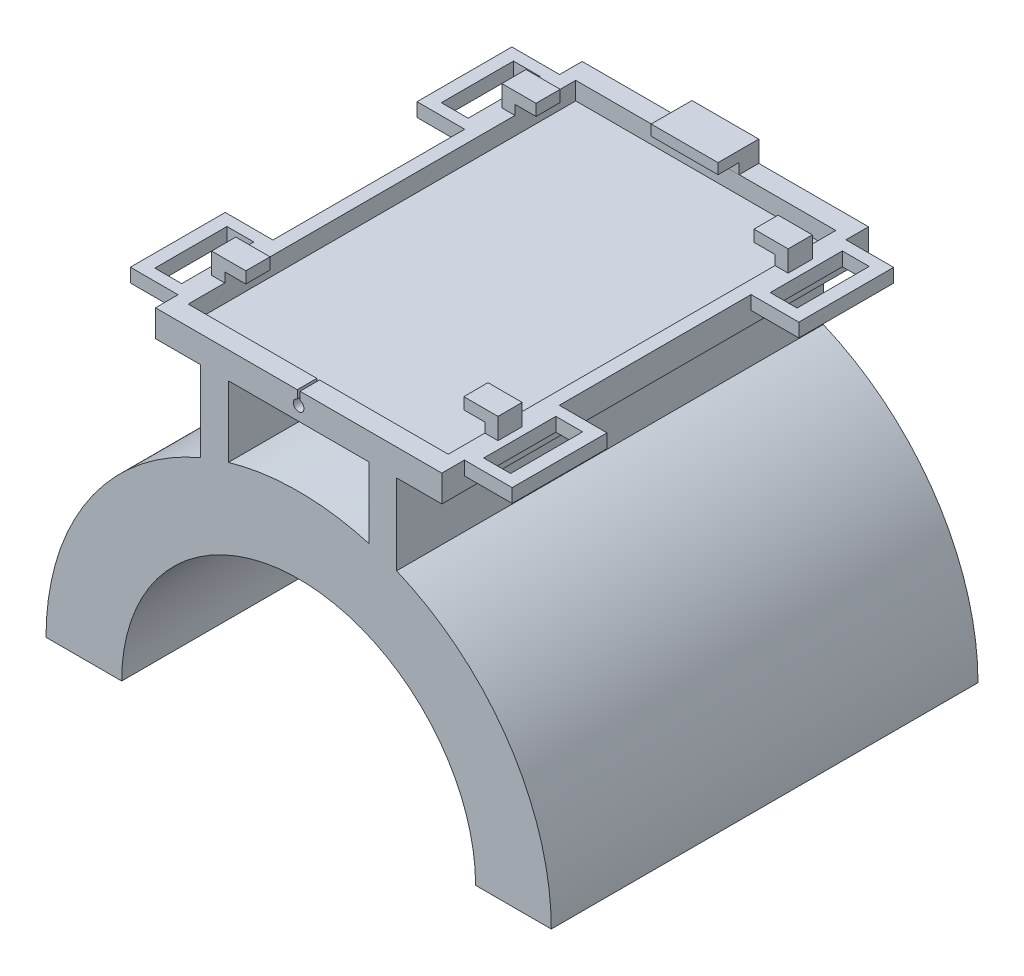
from build123d import *

# Parameters (mm, degrees)
SKETCH1_W                 = 102
SKETCH1_H                 = 152
BOSS_EXTRUDE1_DEPTH       = 3.175
SKETCH2_W                 = 102
SKETCH2_H                 = 152
SKETCH2_W_2               = 92.642768756
SKETCH2_H_2               = 138.055890694
BOSS_EXTRUDE2_DEPTH       = 6.35
CUT_EXTRUDE1_DEPTH        = 161.610477943
CUT_EXTRUDE1_DEPTH_BACK   = 7.175
SKETCH7_W                 = 4.678615622
SKETCH7_H                 = 8.620967169
BOSS_EXTRUDE3_DEPTH       = 7.5
SKETCH8_W                 = 8.620967169
SKETCH8_H                 = 4.074668009
BOSS_EXTRUDE4_DEPTH       = 7.5
MIRROR3_COPY_1_SKETCH_W   = 4.678615622
MIRROR3_COPY_1_SKETCH_H   = 8.620967169
MIRROR3_COPY_1_DEPTH      = 7.5
MIRROR3_COPY_2_SKETCH_W   = 8.620967169
MIRROR3_COPY_2_SKETCH_H   = 4.074668009
MIRROR3_COPY_2_DEPTH      = 7.5
MIRROR3_COPY_3_SKETCH_W   = 4.678615622
MIRROR3_COPY_3_SKETCH_H   = 8.620967169
MIRROR3_COPY_3_DEPTH      = 7.5
MIRROR3_COPY_4_SKETCH_W   = 8.620967169
MIRROR3_COPY_4_SKETCH_H   = 4.074668009
MIRROR3_COPY_4_DEPTH      = 7.5
SKETCH9_W                 = 23.808255756
SKETCH9_H                 = 7.018382857
BOSS_EXTRUDE5_DEPTH       = 7.5
SKETCH10_W                = 23.808255756
SKETCH10_H                = 3.75
BOSS_EXTRUDE6_DEPTH       = 7.5
BOSS_EXTRUDE8_DEPTH       = 76
BOSS_EXTRUDE8_DEPTH_BACK  = 76
BOSS_EXTRUDE10_REACH      = 164.292
BOSS_EXTRUDE10_END_RADIUS = 90
SKETCH14_W                = 9.847508611
SKETCH14_H                = 152
SKETCH26_W                = 33.786428513
SKETCH26_H                = 4.878215465
BOSS_EXTRUDE14_DEPTH      = 17
SKETCH27_W                = 9.556867484
SKETCH27_H                = 25.688859796
CUT_EXTRUDE3_DEPTH        = 17
MIRROR11_COPY_1_SKETCH_W  = 33.786428513
MIRROR11_COPY_1_SKETCH_H  = 4.878215465
MIRROR11_COPY_1_DEPTH     = 17
MIRROR11_COPY_2_SKETCH_W  = 9.556867484
MIRROR11_COPY_2_SKETCH_H  = 25.688859796
MIRROR11_COPY_2_DEPTH     = 17
MIRROR11_COPY_3_SKETCH_W  = 9.556867484
MIRROR11_COPY_3_SKETCH_H  = 25.688859796
MIRROR11_COPY_3_DEPTH     = 17


with BuildPart() as part:
    # Sketch1 → Boss-Extrude1 (new body)
    with BuildSketch(Plane(origin=(0, 0, 0), x_dir=(1, 0, 0), z_dir=(0, 1, 0))):
        Rectangle(SKETCH1_W, SKETCH1_H)
    extrude(amount=BOSS_EXTRUDE1_DEPTH)

    # Sketch2 → Boss-Extrude2 (add)
    with BuildSketch(Plane(origin=(0, 3.175, 0), x_dir=(1, 0, 0), z_dir=(0, 1, 0))):
        Rectangle(SKETCH2_W, SKETCH2_H)
        Rectangle(SKETCH2_W_2, SKETCH2_H_2, mode=Mode.SUBTRACT)
    extrude(amount=BOSS_EXTRUDE2_DEPTH)

    # Sketch5 → Cut-Extrude1 (cut, two sides: drawn at the far end of the back side and taken through both)
    with BuildSketch(Plane.XY.offset(76).offset(-CUT_EXTRUDE1_DEPTH_BACK)):
        with BuildLine():
            Line((-0.489433414, 9.525), (0.489433414, 9.525))
            Line((0.489433414, 9.525), (0.489433414, 6.660364011))
            ThreePointArc((0.489433414, 6.660364011), (0, 2.954695186), (-0.489433414, 6.660364011))
            Line((-0.489433414, 6.660364011), (-0.489433414, 9.525))
        make_face()
    extrude(amount=CUT_EXTRUDE1_DEPTH + CUT_EXTRUDE1_DEPTH_BACK, mode=Mode.SUBTRACT)

    # Sketch7 → Boss-Extrude3 (add)
    with BuildSketch(Plane(origin=(0, 9.525, 0), x_dir=(1, 0, 0), z_dir=(0, 1, 0))):
        with Locations((-48.660692189, -51.682411919)):
            Rectangle(SKETCH7_W, SKETCH7_H)
    boss_extrude3 = extrude(amount=BOSS_EXTRUDE3_DEPTH)

    # Sketch8 → Boss-Extrude4 (add)
    with BuildSketch(Plane(origin=(-46.321384378, 0, 0), x_dir=(0, 0, -1), z_dir=(1, 0, 0))):
        with Locations((-51.682411919, 14.987665996)):
            Rectangle(SKETCH8_W, SKETCH8_H)
    boss_extrude4 = extrude(amount=BOSS_EXTRUDE4_DEPTH)

    # Mirror1: Boss-Extrude3, Boss-Extrude4 across plane
    add(boss_extrude3.mirror(Plane(origin=(0, 0, 0), x_dir=(0, 0, 1), z_dir=(1, 0, 0))))
    add(boss_extrude4.mirror(Plane(origin=(0, 0, 0), x_dir=(0, 0, 1), z_dir=(1, 0, 0))))

    # Mirror3 copy 1 sketch → Mirror3 copy 1 (add)
    with BuildSketch(Plane(origin=(0, 9.525, 0), x_dir=(-1, 0, 0), z_dir=(0, 1, 0))):
        with Locations((-48.660692189, -51.682411919)):
            Rectangle(MIRROR3_COPY_1_SKETCH_W, MIRROR3_COPY_1_SKETCH_H)
    extrude(amount=MIRROR3_COPY_1_DEPTH)

    # Mirror3 copy 2 sketch → Mirror3 copy 2 (add)
    with BuildSketch(Plane.ZY.offset(-46.321384378)):
        with Locations((-51.682411919, 14.987665996)):
            Rectangle(MIRROR3_COPY_2_SKETCH_W, MIRROR3_COPY_2_SKETCH_H)
    extrude(amount=MIRROR3_COPY_2_DEPTH)

    # Mirror3 copy 3 sketch → Mirror3 copy 3 (add)
    with BuildSketch(Plane(origin=(0, 9.525, 0), x_dir=(1, 0, 0), z_dir=(0, 1, 0))):
        with Locations((-48.660692189, 51.682411919)):
            Rectangle(MIRROR3_COPY_3_SKETCH_W, MIRROR3_COPY_3_SKETCH_H)
    extrude(amount=MIRROR3_COPY_3_DEPTH)

    # Mirror3 copy 4 sketch → Mirror3 copy 4 (add)
    with BuildSketch(Plane(origin=(-46.321384378, 0, 0), x_dir=(0, 0, 1), z_dir=(1, 0, 0))):
        with Locations((-51.682411919, -14.987665996)):
            Rectangle(MIRROR3_COPY_4_SKETCH_W, MIRROR3_COPY_4_SKETCH_H)
    extrude(amount=MIRROR3_COPY_4_DEPTH)

    # Sketch9 → Boss-Extrude5 (add)
    with BuildSketch(Plane(origin=(0, 9.525, 0), x_dir=(1, 0, 0), z_dir=(0, 1, 0))):
        with Locations((0, 72.490808571)):
            Rectangle(SKETCH9_W, SKETCH9_H)
    extrude(amount=BOSS_EXTRUDE5_DEPTH)

    # Sketch10 → Boss-Extrude6 (add)
    with BuildSketch(Plane.XY.offset(-68.981617143)):
        with Locations((0, 15.15)):
            Rectangle(SKETCH10_W, SKETCH10_H)
    extrude(amount=BOSS_EXTRUDE6_DEPTH)



with BuildPart() as body_2:
    # Sketch12 → Boss-Extrude8 (new, two sides: drawn at the far end of the back side and taken through both)
    with BuildSketch(Plane.XY.offset(-BOSS_EXTRUDE8_DEPTH_BACK)):
        with BuildLine():
            Line((63.03626042, -111.63657585), (90, -111.63657585))
            ThreePointArc((90, -111.63657585), (0, -21.63657585), (-90, -111.63657585))
            Line((-90, -111.63657585), (-63.03626042, -111.63657585))
            ThreePointArc((-63.03626042, -111.63657585), (0, -48.60031543), (63.03626042, -111.63657585))
        make_face()
    extrude(amount=BOSS_EXTRUDE8_DEPTH + BOSS_EXTRUDE8_DEPTH_BACK)


with BuildPart() as part_1:
    add(part.part)

    add(body_2.part)  # Boss-Extrude10 merges body 2
    # Boss-Extrude10: up to this cylinder (the profile starts outside it)
    boss_extrude10_end = Plane(origin=(0, -111.63657585, 0), z_dir=(0, 0, 1)) * Cylinder(BOSS_EXTRUDE10_END_RADIUS, 509.584, mode=Mode.PRIVATE)
    # Sketch14 → Boss-Extrude10 (add, up to the surface)
    with BuildSketch(Plane.XZ, mode=Mode.PRIVATE) as boss_extrude10_sk1:
        with Locations((-29.964889198, 0)):
            Rectangle(SKETCH14_W, SKETCH14_H)
    boss_extrude10_tool1 = extrude(boss_extrude10_sk1.sketch, amount=BOSS_EXTRUDE10_REACH, mode=Mode.PRIVATE) - boss_extrude10_end
    boss_extrude10 = boss_extrude10_tool1.solids().sort_by_distance((-29.964889, 0, 0))[0]
    add(boss_extrude10)

    # Mirror5: Boss-Extrude10 across plane
    add(boss_extrude10.mirror(Plane(origin=(0, 0, 0), x_dir=(0, 0, 1), z_dir=(1, 0, 0))))

    # Sketch26 → Boss-Extrude14 (add)
    with BuildSketch(Plane(origin=(51, 0, 0), x_dir=(0, 0, -1), z_dir=(1, 0, 0))):
        with Locations((-51.054106613, 7.085892268)):
            Rectangle(SKETCH26_W, SKETCH26_H)
    boss_extrude14 = extrude(amount=BOSS_EXTRUDE14_DEPTH)

    # Sketch27 → Cut-Extrude3 (cut)
    with BuildSketch(Plane(origin=(0, 9.525, 0), x_dir=(1, 0, 0), z_dir=(0, 1, 0))):
        with Locations((58.577916221, -51.033889859)):
            Rectangle(SKETCH27_W, SKETCH27_H)
    cut_extrude3 = extrude(amount=-CUT_EXTRUDE3_DEPTH, mode=Mode.SUBTRACT)

    # Mirror10: Boss-Extrude14, Cut-Extrude3 across plane
    add(boss_extrude14.mirror(Plane(origin=(0, 0, 0), x_dir=(0, 0, 1), z_dir=(1, 0, 0))))
    add(cut_extrude3.mirror(Plane(origin=(0, 0, 0), x_dir=(0, 0, 1), z_dir=(1, 0, 0))), mode=Mode.SUBTRACT)

    # Mirror11: Boss-Extrude14 across plane
    add(boss_extrude14.mirror(Plane.XY))

    # Mirror11 copy 1 sketch → Mirror11 copy 1 (add)
    with BuildSketch(Plane.ZY.offset(51)):
        with Locations((-51.054106613, 7.085892268)):
            Rectangle(MIRROR11_COPY_1_SKETCH_W, MIRROR11_COPY_1_SKETCH_H)
    extrude(amount=MIRROR11_COPY_1_DEPTH)

    # Mirror11 copy 2 sketch → Mirror11 copy 2 (cut)
    with BuildSketch(Plane(origin=(0, 9.525, 0), x_dir=(-1, 0, 0), z_dir=(0, 1, 0))):
        with Locations((58.577916221, -51.033889859)):
            Rectangle(MIRROR11_COPY_2_SKETCH_W, MIRROR11_COPY_2_SKETCH_H)
    extrude(amount=-MIRROR11_COPY_2_DEPTH, mode=Mode.SUBTRACT)

    # Mirror11 copy 3 sketch → Mirror11 copy 3 (cut)
    with BuildSketch(Plane(origin=(0, 9.525, 0), x_dir=(1, 0, 0), z_dir=(0, 1, 0))):
        with Locations((58.577916221, 51.033889859)):
            Rectangle(MIRROR11_COPY_3_SKETCH_W, MIRROR11_COPY_3_SKETCH_H)
    extrude(amount=-MIRROR11_COPY_3_DEPTH, mode=Mode.SUBTRACT)


solid = part_1.part
